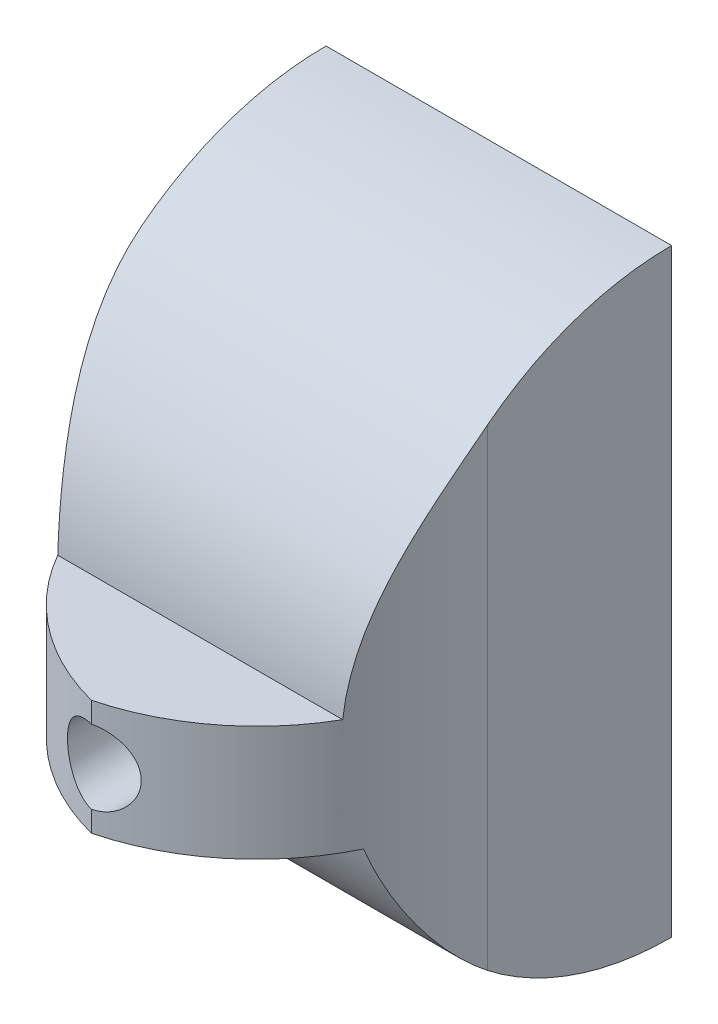
from build123d import *

# Parameters (mm, degrees)
SKETCH1_W           = 15
SKETCH1_H           = 26
BOSS_EXTRUDE1_DEPTH = 18
SKETCH2_R           = 4
CUT_EXTRUDE1_DEPTH  = 11
SKETCH3_R           = 12
CUT_EXTRUDE2_DEPTH  = 9
CUT_EXTRUDE3_START  = -15
SKETCH4_W           = 45.765044891
SKETCH4_H           = 35.646606974
CUT_EXTRUDE3_DEPTH  = 15
FILLET1_R           = 10
SKETCH5_R           = 1.6
CUT_EXTRUDE4_DEPTH  = 5


with BuildPart() as part:
    # Sketch1 → Boss-Extrude1 (new body)
    with BuildSketch(Plane.XY):
        with Locations((7.5, 13)):
            Rectangle(SKETCH1_W, SKETCH1_H)
    extrude(amount=BOSS_EXTRUDE1_DEPTH)

    # Sketch2 → Cut-Extrude1 (cut)
    with BuildSketch(Plane(origin=(13, 0, 0), x_dir=(0, 0, -1), z_dir=(1, 0, 0))):
        with Locations((0, 13)):
            Circle(SKETCH2_R)
    extrude(amount=-CUT_EXTRUDE1_DEPTH, mode=Mode.SUBTRACT)

    # Sketch3 → Cut-Extrude2 (cut)
    with BuildSketch(Plane(origin=(12, 0, 0), x_dir=(0, 0, -1), z_dir=(1, 0, 0))):
        with Locations((0, 13)):
            Circle(SKETCH3_R)
    extrude(amount=-CUT_EXTRUDE2_DEPTH, mode=Mode.SUBTRACT)

    # Sketch4 → Cut-Extrude3 (cut)
    with BuildSketch(Plane(origin=(15, 0, 0), x_dir=(0, 0, -1), z_dir=(1, 0, 0)).offset(CUT_EXTRUDE3_START)):
        with Locations((-7.490754188, 14.288489829)):
            Rectangle(SKETCH4_W, SKETCH4_H)
        with BuildLine():
            Line((-20.423780573, 14), (-12.961481397, 14))
            ThreePointArc((-12.961481397, 14), (12.909776733, 14.528942348), (-12.369316877, 9))
            Line((-12.369316877, 9), (-20.423780573, 9))
            Line((-20.423780573, 9), (-20.423780573, 14))
        make_face(mode=Mode.SUBTRACT)
    extrude(amount=CUT_EXTRUDE3_DEPTH, mode=Mode.SUBTRACT)

    # Fillet1
    # the kernel refuses this fillet: 10 mm, written as the material it takes off along each edge
    with BuildSketch(Plane(origin=(15, -16, 18), x_dir=(0, 0, -1), z_dir=(0, 1, 0)), Plane(origin=(0, 39, 18), x_dir=(0, 0, -1), z_dir=(0, -1, 0))) as fillet1_piece_1:
        with BuildLine():
            CenterArc((FILLET1_R, FILLET1_R), FILLET1_R, 180, 90)
            Line((0, FILLET1_R), (0, 0))
            Line((0, 0), (FILLET1_R, 0))
        make_face()
    extrude(amount=55, mode=Mode.SUBTRACT)

    # Sketch5 → Cut-Extrude4 (cut)
    with BuildSketch(Plane.XY.offset(18)):
        with Locations((7.5, 11.5)):
            Circle(SKETCH5_R)
    extrude(amount=-CUT_EXTRUDE4_DEPTH, mode=Mode.SUBTRACT)


solid = part.part
